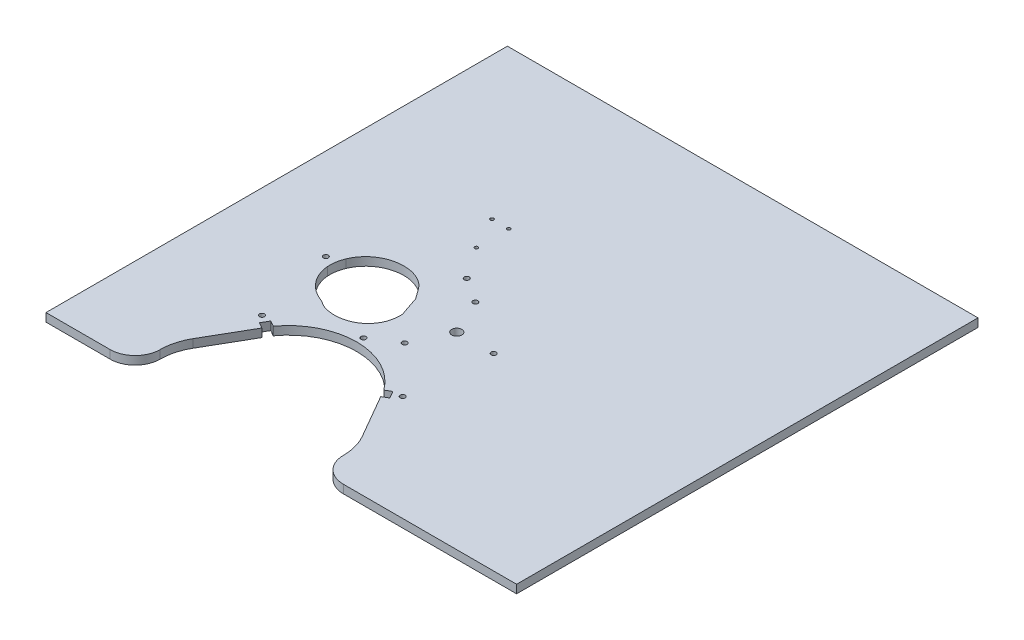
from build123d import *

# Parameters (mm, degrees)
ESQUISSE1_W             = 282.497861144
ESQUISSE1_H             = 276.982873123
BOSS_EXTRU_1_DEPTH      = 5
ESQUISSE2_R             = 1.5
ENL_V_MAT_EXTRU_2_DEPTH = 284.291382269
ENL_V_MAT_EXTRU_3_DEPTH = 284.291382269
ESQUISSE4_R             = 3
ENL_V_MAT_EXTRU_4_DEPTH = 284.291382407
ESQUISSE5_R             = 1
ENL_V_MAT_EXTRU_5_DEPTH = 284.291382407
ESQUISSE6_R             = 1.5
ENL_V_MAT_EXTRU_6_DEPTH = 284.291382407


with BuildPart() as part:
    # Esquisse1 → Boss.-Extru.1 (new body)
    with BuildSketch(Plane(origin=(0, 0, 0), x_dir=(1, 0, 0), z_dir=(0, 1, 0))):
        with Locations((0.748930572, -106.591436562)):
            Rectangle(ESQUISSE1_W, ESQUISSE1_H)
    extrude(amount=BOSS_EXTRU_1_DEPTH)

    # Esquisse2 → Enlèv. mat.-Extru.2 (cut, through all)
    with BuildSketch(Plane(origin=(0, 0, 0), x_dir=(1, 0, 0), z_dir=(0, 1, 0))):
        with Locations((-74.225778058, -181.665063509)):
            Circle(ESQUISSE2_R)
        with Locations((10.225778058, -181.665063509)):
            Circle(ESQUISSE2_R)
        with BuildLine():
            Line((-65.181549424, -184), (-68.645651039, -182))
            Line((-68.645651039, -182), (-71.145651039, -186.330127019))
            Line((-71.145651039, -186.330127019), (-67.681549424, -188.330127019))
            Line((-67.681549424, -188.330127019), (-82.853895909, -214.609402001))
            ThreePointArc((-82.853895909, -214.609402001), (-85.945508514, -222.073215083), (-87, -230.082873123))
            ThreePointArc((-87, -230.082873123), (-91.393398282, -240.68947484), (-102, -245.082873123))
            Line((-102, -245.082873123), (38, -245.082873123))
            ThreePointArc((38, -245.082873123), (27.393398282, -240.68947484), (23, -230.082873123))
            ThreePointArc((23, -230.082873123), (21.945508514, -222.073215083), (18.853895909, -214.609402001))
            Line((18.853895909, -214.609402001), (3.681549424, -188.330127019))
            Line((3.681549424, -188.330127019), (7.145651039, -186.330127019))
            Line((7.145651039, -186.330127019), (4.645651039, -182))
            Line((4.645651039, -182), (1.181549424, -184))
            ThreePointArc((1.181549424, -184), (-32, -167.082873123), (-65.181549424, -184))
        make_face()
    extrude(amount=ENL_V_MAT_EXTRU_2_DEPTH, mode=Mode.SUBTRACT)

    # Esquisse3 → Enlèv. mat.-Extru.3 (cut, through all)
    with BuildSketch(Plane(origin=(0, 5, 0), x_dir=(1, 0, 0), z_dir=(0, 1, 0))):
        with BuildLine():
            Line((-32.638143912, -138.899718983), (-36.712212948, -126.940704586))
            add(Edge.make_bspline(
                [(-36.712212948, -126.940704586), (-37.048904216, -126.418336328), (-37.766305726, -125.381131487), (-38.812265977, -123.935128708), (-39.878332027, -122.469534731), (-40.623099536, -121.488619792), (-41.002631757, -121.007496673)],
                knots=[-0.026312885, -0.026312885, -0.026312885, -0.026312885, 0.230265337, 0.486843558, 0.743421779, 1, 1, 1, 1], degree=3))
            add(Edge.make_bspline(
                [(-41.002631757, -121.007496673), (-41.381579069, -120.527115029), (-41.959473044, -119.824889923), (-42.812799731, -118.913204336), (-43.292805973, -118.457759953), (-43.538225078, -118.243314113)],
                knots=[0, 0, 0, 0, 0.5, 0.75, 1, 1, 1, 1], degree=3))
            add(Edge.make_bspline(
                [(-43.538225078, -118.243314113), (-44.208500846, -117.657630903), (-45.667962624, -116.598353358), (-48.742188958, -114.960550755), (-52.956730086, -113.658865939), (-58.101177426, -113.267605582), (-62.419932687, -113.880240127), (-65.680157742, -114.909771139), (-68.06023739, -115.961447672), (-70.303771396, -117.275668477), (-73.044083587, -119.329814435), (-75.451366957, -121.917152633), (-77.295650699, -124.810178937), (-78.058263929, -126.382818441), (-78.387672193, -127.185427006)],
                knots=[0, 0, 0, 0, 0.0625, 0.125, 0.25, 0.375, 0.5, 0.5625, 0.625, 0.6875, 0.75, 0.875, 0.9375, 1, 1, 1, 1], degree=3))
            add(Edge.make_bspline(
                [(-78.387672193, -127.185427006), (-78.99506812, -128.665357011), (-79.88337733, -131.767096175), (-80.038288734, -135.007185605), (-79.92446401, -136.606487873)],
                knots=[0, 0, 0, 0, 0.5, 1, 1, 1, 1], degree=3))
            add(Edge.make_bspline(
                [(-79.92446401, -136.606487873), (-79.83805998, -137.82051377), (-79.454814206, -140.230898233), (-78.225504754, -143.730824287), (-76.451458258, -146.912993039), (-74.544703782, -149.316170286), (-72.843457563, -151.014709906), (-71.453684421, -152.206202825), (-70.200315614, -153.101802725), (-69.232608666, -153.737266254), (-68.161506751, -154.400176588), (-66.813754105, -155.092923736), (-65.435876003, -155.68711757), (-64.516225172, -156.07391239), (-64.014492075, -156.29226497), (-63.486298178, -156.526337489), (-63.19191503, -156.687178878), (-62.766183331, -156.97641658), (-62.523589347, -157.148239403), (-62.405763846, -157.230400388)],
                knots=[0, 0, 0, 0, 0.125, 0.25, 0.375, 0.5, 0.5625, 0.625, 0.6875, 0.71875, 0.75, 0.8125, 0.875, 0.90625, 0.921875, 0.9375, 0.96875, 0.984375, 1, 1, 1, 1], degree=3))
            add(Edge.make_bspline(
                [(-62.405763846, -157.230400388), (-62.30331629, -157.301838167), (-62.105450004, -157.439472785), (-61.759683948, -157.667572422), (-61.413901055, -157.876196362), (-61.084159975, -158.065686566), (-60.631721284, -158.29356731), (-60.222233643, -158.450072899), (-59.880659769, -158.576380955), (-59.397790186, -158.744903221), (-58.796486917, -158.937123494), (-57.819928358, -159.212056031), (-57.077898517, -159.379488194), (-56.579967732, -159.47379778)],
                knots=[0, 0, 0, 0, 0.0625, 0.125, 0.1875, 0.25, 0.3125, 0.375, 0.4375, 0.5, 0.625, 0.75, 1, 1, 1, 1], degree=3))
            add(Edge.make_bspline(
                [(-56.579967732, -159.47379778), (-53.914810771, -159.978586514), (-51.107012262, -159.980907132), (-48.442347714, -159.473525482)],
                knots=[0, 0, 0, 0, 1, 1, 1, 1], degree=3))
            add(Edge.make_bspline(
                [(-48.442347714, -159.473525482), (-46.335404353, -159.072340125), (-44.262549123, -158.344663126), (-42.380327547, -157.316362607)],
                knots=[0, 0, 0, 0, 1, 1, 1, 1], degree=3))
            add(Edge.make_bspline(
                [(-42.380327547, -157.316362607), (-41.575487433, -156.87666012), (-40.025218713, -155.874491409), (-37.961266031, -154.0690569), (-36.143334045, -151.931635283), (-34.695962765, -149.599440785), (-33.584704483, -147.023721845), (-32.88358498, -144.363794904), (-32.608694798, -142.076950982), (-32.57478635, -140.476849071), (-32.597884175, -139.560315534), (-32.624348434, -139.121438901), (-32.638143912, -138.899718983)],
                knots=[0, 0, 0, 0, 0.126247937, 0.252495875, 0.378743812, 0.504991749, 0.631239686, 0.757487624, 0.883735561, 0.94685953, 0.978421514, 1.009983498, 1.009983498, 1.009983498, 1.009983498], degree=3))
        make_face()
    extrude(amount=-ENL_V_MAT_EXTRU_3_DEPTH, mode=Mode.SUBTRACT)

    # Esquisse4 → Enlèv. mat.-Extru.4 (cut, through all)
    with BuildSketch(Plane(origin=(0, 5, 0), x_dir=(1, 0, 0), z_dir=(0, 1, 0))):
        with Locations((-7, -132)):
            Circle(ESQUISSE4_R)
    extrude(amount=-ENL_V_MAT_EXTRU_4_DEPTH, mode=Mode.SUBTRACT)

    # Esquisse5 → Enlèv. mat.-Extru.5 (cut, through all)
    with BuildSketch(Plane.XZ):
        with Locations((-45.1, 82.15)):
            Circle(ESQUISSE5_R)
        with Locations((-55.2, 62.65)):
            Circle(ESQUISSE5_R)
        with Locations((-45.1, 62.65)):
            Circle(ESQUISSE5_R)
    extrude(amount=-ENL_V_MAT_EXTRU_5_DEPTH, mode=Mode.SUBTRACT)

    # Esquisse6 → Enlèv. mat.-Extru.6 (cut, through all)
    with BuildSketch(Plane(origin=(0, 5, 0), x_dir=(1, 0, 0), z_dir=(0, 1, 0))):
        with Locations((-85.6, -132)):
            Circle(ESQUISSE6_R)
        with Locations((-32, -163)):
            Circle(ESQUISSE6_R)
        with Locations((-17.050791121, -153.25)):
            Circle(ESQUISSE6_R)
        with Locations((15.122359024, -132)):
            Circle(ESQUISSE6_R)
        with Locations((-32, -101)):
            Circle(ESQUISSE6_R)
        with Locations((-17.050791121, -110.75)):
            Circle(ESQUISSE6_R)
    extrude(amount=-ENL_V_MAT_EXTRU_6_DEPTH, mode=Mode.SUBTRACT)


solid = part.part
